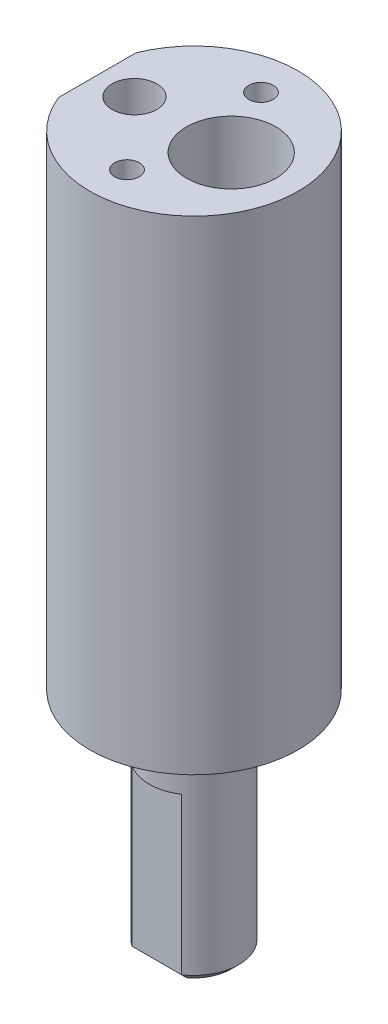
from build123d import *

# Parameters (mm, degrees)
BOSS_EXTRUDE2_DEPTH   = 22
SKETCH6_R             = 6
BOSS_EXTRUDE3_DEPTH   = 8
BOSS_EXTRUDE4_DEPTH   = 65
SKETCH8_R             = 3
CUT_EXTRUDE5_DEPTH    = 65
SKETCH9_R             = 6
CUT_EXTRUDE6_DEPTH    = 52
M4_TAPPED_HOLE1_D     = 3.3
M4_TAPPED_HOLE1_DEPTH = 14
M4_TAPPED_HOLE1_TIP   = 0.991420021
SKETCH13_R            = 1.5
SKETCH13_R_2          = 2.5
CUT_EXTRUDE7_DEPTH    = 5
SKETCH14_R            = 1
CUT_EXTRUDE8_DEPTH    = 15
CHAMFER1_SIZE         = 1


with BuildPart() as part:
    # Sketch2 → Boss-Extrude2 (new body)
    with BuildSketch(Plane(origin=(0, 0, 0), x_dir=(1, 0, 0), z_dir=(0, 1, 0))):
        with BuildLine():
            Line((3.31662479, -5), (-3.31662479, -5))
            ThreePointArc((-3.31662479, -5), (0, 6), (3.31662479, -5))
        make_face()
    extrude(amount=BOSS_EXTRUDE2_DEPTH)

    # Sketch6 → Boss-Extrude3 (add)
    with BuildSketch(Plane(origin=(0, 22, 0), x_dir=(1, 0, 0), z_dir=(0, 1, 0))):
        with Locations(Location((0, 0, 0), (0, 0, 236.442690238))):
            Circle(SKETCH6_R)
    extrude(amount=BOSS_EXTRUDE3_DEPTH)

    # Sketch7 → Boss-Extrude4 (add)
    with BuildSketch(Plane(origin=(0, 30, 0), x_dir=(1, 0, 0), z_dir=(0, 1, 0))):
        with BuildLine():
            Line((-13, 5.196152423), (-13, -5.196152423))
            ThreePointArc((-13, -5.196152423), (14, 0), (-13, 5.196152423))
        make_face()
    extrude(amount=BOSS_EXTRUDE4_DEPTH)

    # Sketch8 → Cut-Extrude5 (cut)
    with BuildSketch(Plane(origin=(0, 95, 0), x_dir=(1, 0, 0), z_dir=(0, 1, 0))):
        with Locations(Location((-8, 0, 0), (0, 0, 270))):
            Circle(SKETCH8_R)
    extrude(amount=-CUT_EXTRUDE5_DEPTH, mode=Mode.SUBTRACT)

    # Sketch9 → Cut-Extrude6 (cut)
    with BuildSketch(Plane(origin=(0, 95, 0), x_dir=(1, 0, 0), z_dir=(0, 1, 0))):
        with Locations(Location((5, 0, 0), (0, 0, 270))):
            Circle(SKETCH9_R)
    extrude(amount=-CUT_EXTRUDE6_DEPTH, mode=Mode.SUBTRACT)

    # M4 Tapped Hole1
    with Locations(Plane(origin=(0, 95, -9), x_dir=(0, 0, 1), z_dir=(0, 1, 0))):
        with Locations((0, 0), (18, 0)):
            Hole(M4_TAPPED_HOLE1_D / 2, depth=M4_TAPPED_HOLE1_DEPTH)
            with Locations((0, 0, -(M4_TAPPED_HOLE1_DEPTH + M4_TAPPED_HOLE1_TIP / 2))):  # 118° drill point
                Cone(0, M4_TAPPED_HOLE1_D / 2, M4_TAPPED_HOLE1_TIP, mode=Mode.SUBTRACT)

    # Sketch13 → Cut-Extrude7 (cut)
    with BuildSketch(Plane.ZY.offset(13)):
        with Locations((0, 34)):
            Circle(SKETCH13_R)
        with Locations((0, 63)):
            Circle(SKETCH13_R_2)
    extrude(amount=-CUT_EXTRUDE7_DEPTH, mode=Mode.SUBTRACT)

    # Sketch14 → Cut-Extrude8 (cut)
    with BuildSketch(Plane.ZY.offset(13)):
        with Locations((0, 85)):
            Circle(SKETCH14_R)
        with Locations((0, 43)):
            Circle(SKETCH14_R)
    extrude(amount=-CUT_EXTRUDE8_DEPTH, mode=Mode.SUBTRACT)

    # Chamfer1
    chamfer1_edges = [part.edges().sort_by_distance(p)[0] for p in [
        (0, 0, 5),
        (0, 0, -6),
    ]]
    chamfer(chamfer1_edges, length=CHAMFER1_SIZE - 0.0001)  # a hair under: the kernel refuses the full size


solid = part.part
